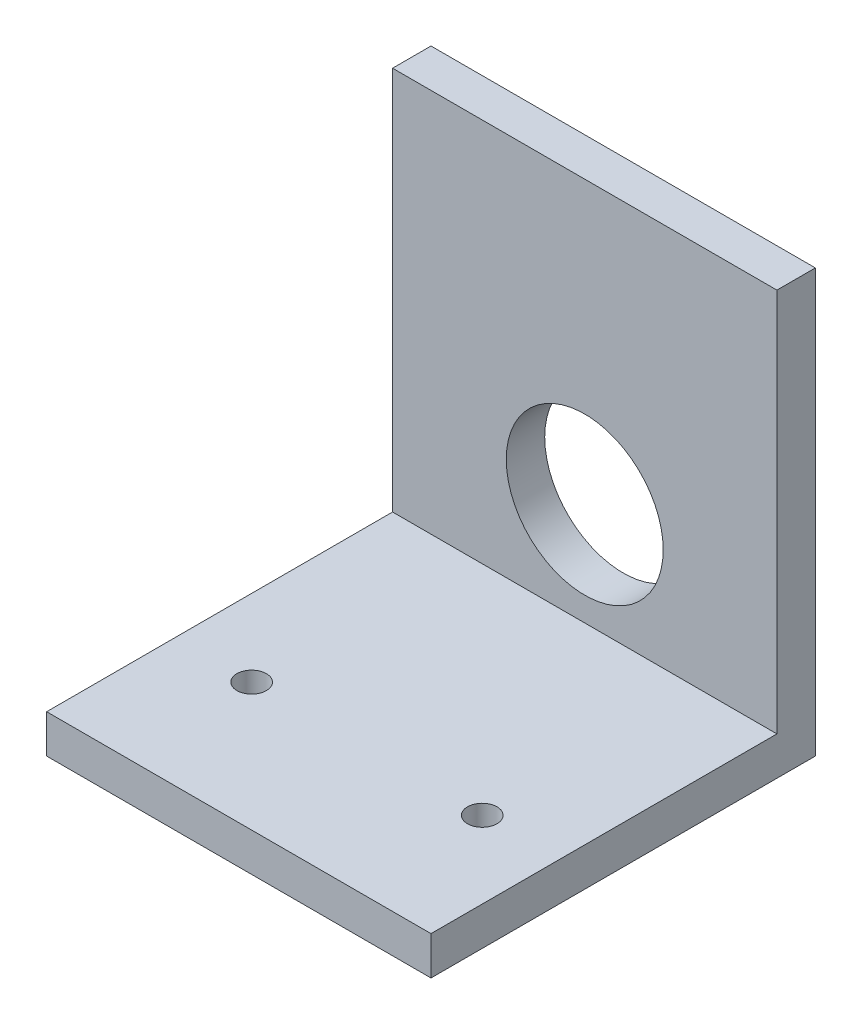
from build123d import *

# Parameters (mm, degrees)
SKETCH1_W           = 30
SKETCH1_H           = 30
SKETCH1_R           = 1.15
BOSS_EXTRUDE1_DEPTH = 3
SKETCH2_W           = 30
SKETCH2_H           = 3
BOSS_EXTRUDE2_DEPTH = 30
CUT_EXTRUDE1_REACH  = 55.749
SKETCH3_R           = 6.125


with BuildPart() as part:
    # Sketch1 → Boss-Extrude1 (new body)
    with BuildSketch(Plane(origin=(0, 0, 0), x_dir=(1, 0, 0), z_dir=(0, 1, 0))):
        with Locations((15, 15)):
            Rectangle(SKETCH1_W, SKETCH1_H)
        with Locations((5.999988, 9.999999964)):
            Circle(SKETCH1_R, mode=Mode.SUBTRACT)
        with Locations((23.999988, 9.999999964)):
            Circle(SKETCH1_R, mode=Mode.SUBTRACT)
    extrude(amount=BOSS_EXTRUDE1_DEPTH)

    # Sketch2 → Boss-Extrude2 (add)
    with BuildSketch(Plane(origin=(0, 3, 0), x_dir=(1, 0, 0), z_dir=(0, 1, 0))):
        with Locations((15, 28.5)):
            Rectangle(SKETCH2_W, SKETCH2_H)
    extrude(amount=BOSS_EXTRUDE2_DEPTH)

    # Sketch3 → Cut-Extrude1 (cut, up to next)
    with BuildSketch(Plane(origin=(0, 0, -30), x_dir=(-1, 0, 0), z_dir=(0, 0, -1)), mode=Mode.PRIVATE) as cut_extrude1_sk1:
        with Locations((-15, 11)):
            Circle(SKETCH3_R)
    cut_extrude1_tool1 = extrude(cut_extrude1_sk1.sketch, amount=-CUT_EXTRUDE1_REACH, mode=Mode.PRIVATE) & part.part
    add(cut_extrude1_tool1.solids().sort_by_distance((15, 11, -30))[0], mode=Mode.SUBTRACT)


solid = part.part
